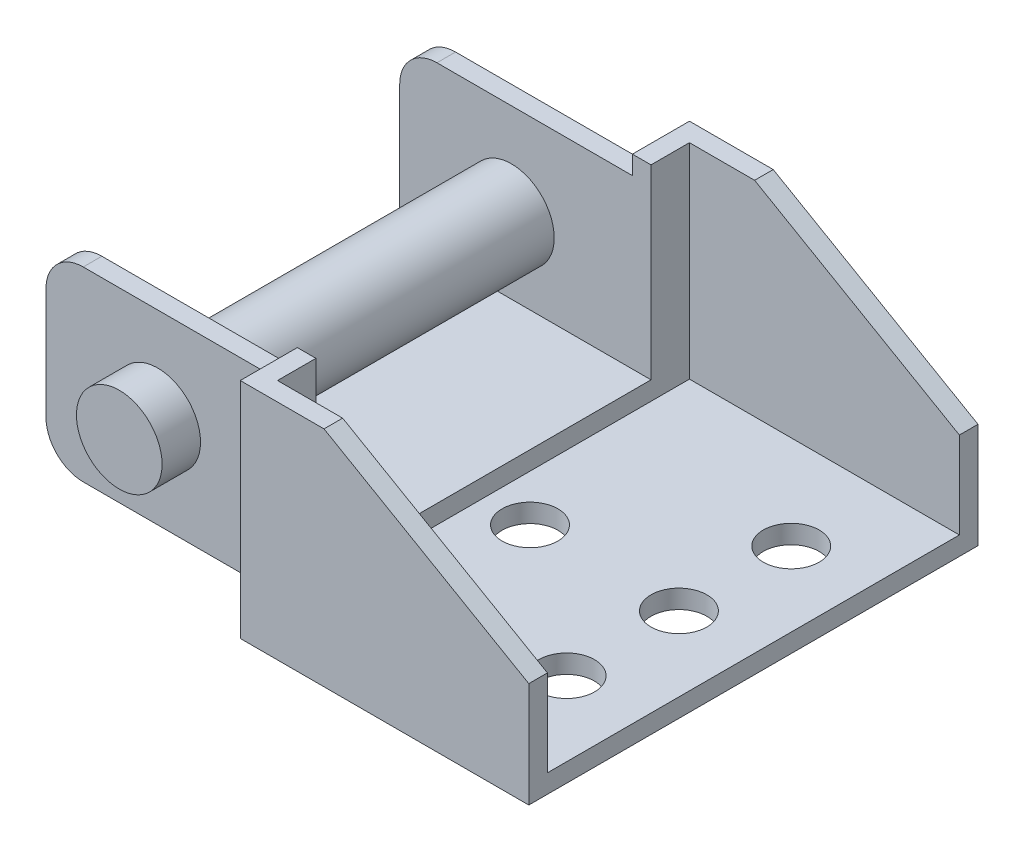
from build123d import *

# Parameters (mm, degrees)
SKETCH1_R           = 2.3
BOSS_EXTRUDE1_DEPTH = 12.065
SKETCH5_R           = 1.5
SKETCH5_W           = 12.5
SKETCH5_H           = 2.065
CUT_EXTRUDE3_DEPTH  = 28.813022579
SKETCH6_W           = 18
SKETCH6_H           = 10
CUT_EXTRUDE5_DEPTH  = 32.07352933
SKETCH9_W           = 20
SKETCH9_H           = 1
CUT_EXTRUDE8_DEPTH  = 12.5
BOSS_EXTRUDE2_START = -24.13
SKETCH7_R           = 2.3
BOSS_EXTRUDE2_DEPTH = 24.13
SKETCH8_W           = 12.5
SKETCH8_H           = 1
CUT_EXTRUDE6_DEPTH  = 1
FILLET3_R           = 2
CUT_EXTRUDE9_DEPTH  = 14.5


with BuildPart() as part:
    # Sketch1 → Boss-Extrude1 (new, symmetric)
    with BuildSketch(Plane.XY):
        Polygon((22, -6), (0, -6), (-6, -6), (-6, 6), (0, 6), (11, 6), (22, -0.350852961), align=None)
        with Locations(Location((0, 0, 0), (0, 0, 180))):
            Circle(SKETCH1_R, mode=Mode.SUBTRACT)
    extrude(amount=BOSS_EXTRUDE1_DEPTH, both=True)

    # Sketch5 → Cut-Extrude3 (cut, through all)
    with BuildSketch(Plane(origin=(0, 6, 0), x_dir=(1, 0, 0), z_dir=(0, 1, 0))):
        with Locations(Location((18, 6.0325, 0), (0, 0, 270))):
            Circle(SKETCH5_R)
        with Locations(Location((18, 0, 0), (0, 0, 270))):
            Circle(SKETCH5_R)
        with Locations(Location((18, -6.0325, 0), (0, 0, 270))):
            Circle(SKETCH5_R)
        with Locations(Location((10, 0, 0), (0, 0, 270))):
            Circle(SKETCH5_R)
        with Locations((0.25, -11.0325)):
            Rectangle(SKETCH5_W, SKETCH5_H)
        with Locations((0.25, 11.0325)):
            Rectangle(SKETCH5_W, SKETCH5_H)
    extrude(amount=-CUT_EXTRUDE3_DEPTH, mode=Mode.SUBTRACT)

    # Sketch6 → Cut-Extrude5 (cut, through all)
    with BuildSketch(Plane.ZY.offset(6)):
        with Locations((0, 1)):
            Rectangle(SKETCH6_W, SKETCH6_H)
    extrude(amount=-CUT_EXTRUDE5_DEPTH, mode=Mode.SUBTRACT)

    # Sketch9 → Cut-Extrude8 (cut)
    with BuildSketch(Plane.ZY.offset(6)):
        with Locations((0, -5.5)):
            Rectangle(SKETCH9_W, SKETCH9_H)
    extrude(amount=-CUT_EXTRUDE8_DEPTH, mode=Mode.SUBTRACT)

    # Sketch7 → Boss-Extrude2 (add)
    with BuildSketch(Plane.XY.offset(12.065).offset(BOSS_EXTRUDE2_START)):
        Circle(SKETCH7_R)
    extrude(amount=BOSS_EXTRUDE2_DEPTH)

    # Sketch8 → Cut-Extrude6 (cut)
    with BuildSketch(Plane(origin=(0, 6, 0), x_dir=(1, 0, 0), z_dir=(0, 1, 0))):
        with Locations((0.25, -9.5)):
            Rectangle(SKETCH8_W, SKETCH8_H)
        with Locations((0.25, 9.5)):
            Rectangle(SKETCH8_W, SKETCH8_H)
    extrude(amount=-CUT_EXTRUDE6_DEPTH, mode=Mode.SUBTRACT)

    # Fillet3
    # the kernel refuses this fillet: 2 mm, written as the material it takes off along each edge
    with BuildSketch(Plane(origin=(-6, -5, 15), x_dir=(1, 0, 0), z_dir=(0, 0, -1))) as fillet3_piece_1:
        with BuildLine():
            CenterArc((FILLET3_R, -FILLET3_R), FILLET3_R, 90, 90)
            Line((0, -FILLET3_R), (0, 0))
            Line((0, 0), (FILLET3_R, 0))
        make_face()
    extrude(amount=30, mode=Mode.SUBTRACT)
    with BuildSketch(Plane(origin=(-6, 5, -15), x_dir=(1, 0, 0), z_dir=(0, 0, 1)), Plane(origin=(-6, 5, 4), x_dir=(1, 0, 0), z_dir=(0, 0, 1))) as fillet3_piece_2:
        with BuildLine():
            CenterArc((FILLET3_R, -FILLET3_R), FILLET3_R, 90, 90)
            Line((0, -FILLET3_R), (0, 0))
            Line((0, 0), (FILLET3_R, 0))
        make_face()
    extrude(amount=11, mode=Mode.SUBTRACT)

    # Sketch10 → Cut-Extrude9 (cut)
    with BuildSketch(Plane(origin=(22, 0, 0), x_dir=(0, 0, -1), z_dir=(1, 0, 0))):
        Polygon((-9, -4), (-9, 6), (-11.065, 6), (-11.065, -4), (-11.065, -5), (11.065, -5), (11.065, -4), (11.065, 6), (9, 6), (9, -4), align=None)
    extrude(amount=-CUT_EXTRUDE9_DEPTH, mode=Mode.SUBTRACT)


solid = part.part
